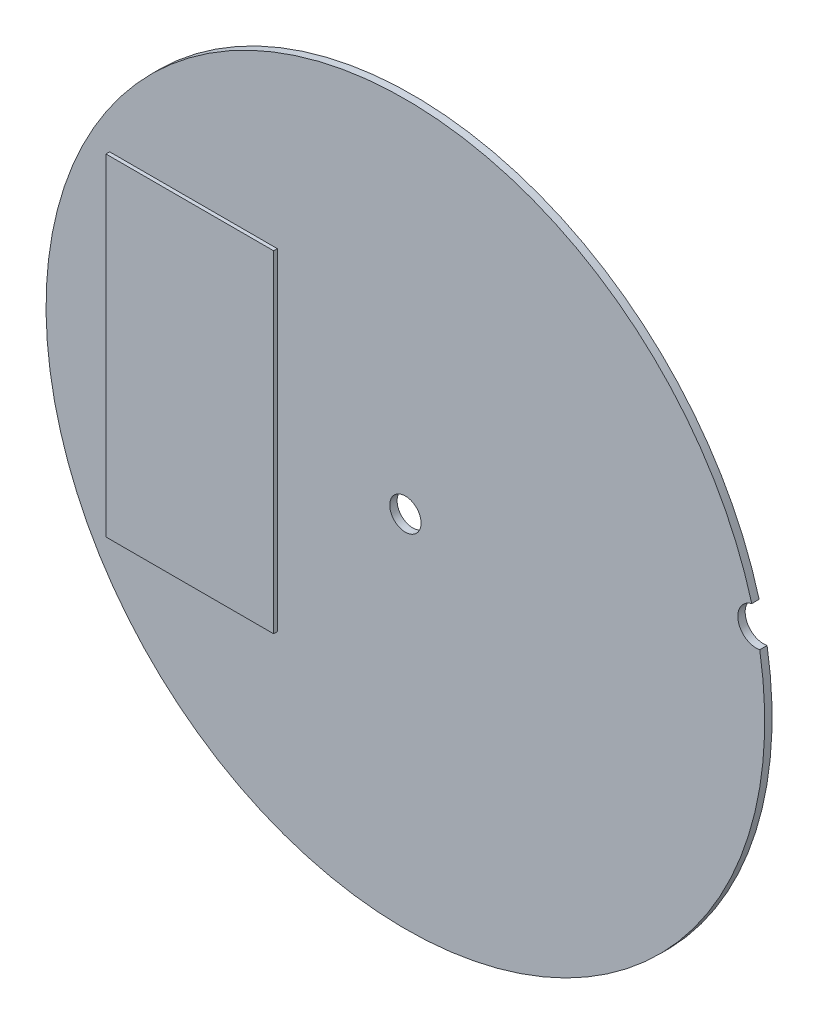
from build123d import *

# Parameters (mm, degrees)
ESQUISSE1_R        = 0.85
BOSS_EXTRU_1_DEPTH = 0.4
ESQUISSE2_W        = 9.1
ESQUISSE2_H        = 18
BOSS_EXTRU_2_DEPTH = 0.2


with BuildPart() as part:
    # Esquisse1 → Boss.-Extru.1 (new body)
    with BuildSketch(Plane.XY):
        with BuildLine():
            ThreePointArc((18.796370456, 5.190997754), (-19.037772139, -4.220572472), (19.22910736, 3.239047723))
            ThreePointArc((19.22910736, 3.239047723), (18.061476132, 4.004132858), (18.796370456, 5.190997754))
        make_face()
        Circle(ESQUISSE1_R, mode=Mode.SUBTRACT)
        with BuildLine():
            Line((-14.5, -4.5), (-14.5, 4.5))
            ThreePointArc((-14.5, 4.5), (-11.5, 7.5), (-8.5, 4.5))
            Line((-8.5, 4.5), (-8.5, -4.5))
            ThreePointArc((-8.5, -4.5), (-11.5, -7.5), (-14.5, -4.5))
        make_face(mode=Mode.SUBTRACT)
    extrude(amount=BOSS_EXTRU_1_DEPTH)

    # Esquisse2 → Boss.-Extru.2 (add)
    with BuildSketch(Plane.XY.offset(0.4)):
        with Locations((-11.5, 0)):
            Rectangle(ESQUISSE2_W, ESQUISSE2_H)
    extrude(amount=BOSS_EXTRU_2_DEPTH)


solid = part.part
